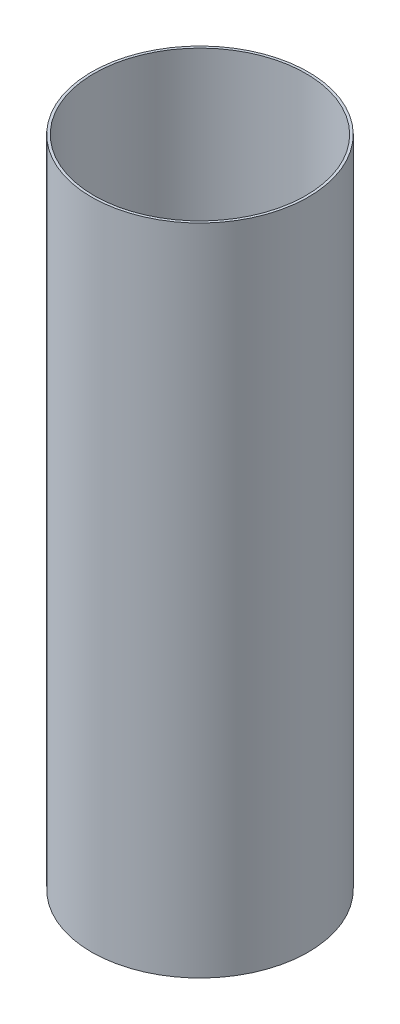
from build123d import *

# Parameters (mm, degrees)
SKETCH1_R           = 33.16
SKETCH1_R_2         = 32.385
BOSS_EXTRUDE1_DEPTH = 100


with BuildPart() as part:
    # Sketch1 → Boss-Extrude1 (new, symmetric)
    with BuildSketch(Plane(origin=(0, 0, 0), x_dir=(1, 0, 0), z_dir=(0, 1, 0))):
        Circle(SKETCH1_R)
        Circle(SKETCH1_R_2, mode=Mode.SUBTRACT)
    extrude(amount=BOSS_EXTRUDE1_DEPTH, both=True)


solid = part.part
